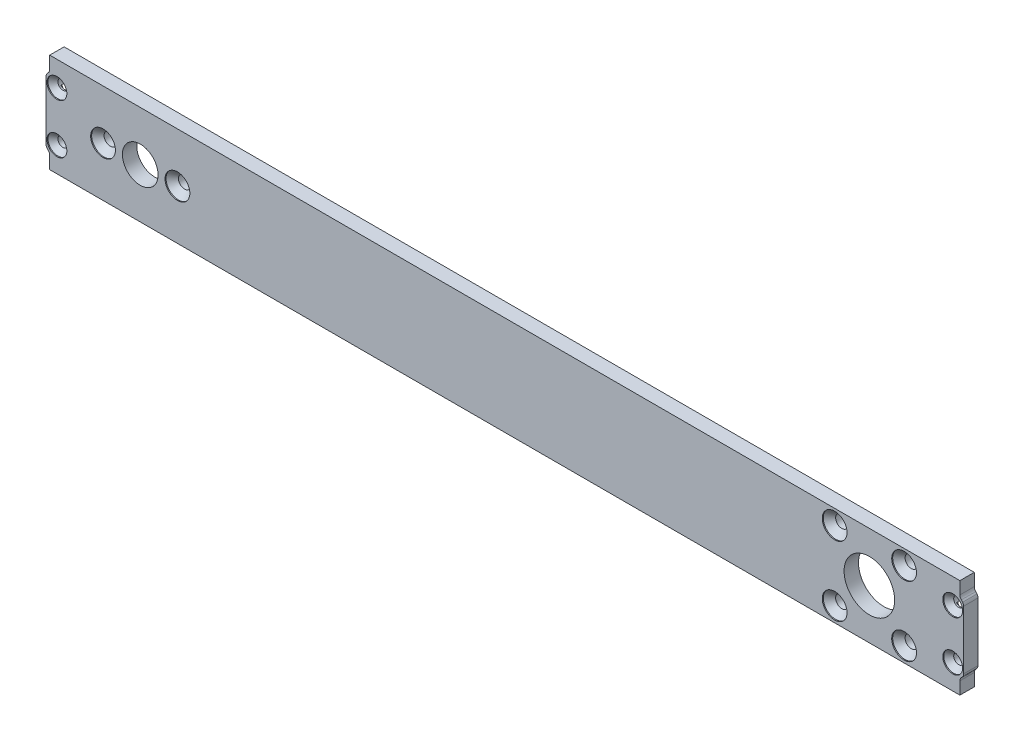
from build123d import *
from build123d.topology import SkipClean

# Parameters (mm, degrees)
SKETCH1_W                          = 185
SKETCH1_H                          = 20
BASE_SHAPE_DEPTH                   = 2.9
MOTOR_CUTOUTS_REACH                = 95.084
SKETCH2_R                          = 1.25
SKETCH2_R_2                        = 3.6
SKETCH2_R_3                        = 5.1
PCB_SLOT_DEPTH                     = 0.775
END_PLATE_HOLES_REACH              = 95.084
SKETCH6_R                          = 1
MOTOR_M2_5_COUNTERSUNKS_AT_2_COUNT = 2
MOTOR_M2_5_COUNTERSUNKS_AT_2_PITCH = 15
MOTOR_M2_5_COUNTERSUNKS_AT_3_COUNT = 2
MOTOR_M2_5_COUNTERSUNKS_AT_3_PITCH = 147.666008275
MOTOR_M2_5_COUNTERSUNKS_AT_4_COUNT = 2
MOTOR_M2_5_COUNTERSUNKS_AT_4_PITCH = 161.651631603
MOTOR_M2_5_COUNTERSUNKS_AT_5_COUNT = 2
MOTOR_M2_5_COUNTERSUNKS_AT_5_PITCH = 147.666008275
MOTOR_M2_5_COUNTERSUNKS_AT_6_COUNT = 2
MOTOR_M2_5_COUNTERSUNKS_AT_6_PITCH = 161.651631603
END_M2_COUNTERSUNKS_AT_2_COUNT     = 2
END_M2_COUNTERSUNKS_AT_2_PITCH     = 10
END_M2_COUNTERSUNKS_AT_3_COUNT     = 2
END_M2_COUNTERSUNKS_AT_3_PITCH     = 180.6
END_M2_COUNTERSUNKS_AT_4_COUNT     = 2
END_M2_COUNTERSUNKS_AT_4_PITCH     = 180.876643047
TAP_START                          = -1.4
TAP_SLOTS_DEPTH                    = 1.4
CUT_EXTRUDE3_REACH                 = 95.084
FILLET1_R                          = 1


with BuildPart() as part:
    # Sketch1 → Base shape (new body)
    with BuildSketch(Plane.XY):
        Rectangle(SKETCH1_W, SKETCH1_H)
    extrude(amount=-BASE_SHAPE_DEPTH)

    # Sketch2 → Motor cutouts (cut, up to next)
    with BuildSketch(Plane.XY, mode=Mode.PRIVATE) as motor_cutouts_sk1:
        with Locations((-81, 0)):
            Circle(SKETCH2_R)
    motor_cutouts_tool1 = extrude(motor_cutouts_sk1.sketch, amount=-MOTOR_CUTOUTS_REACH, mode=Mode.PRIVATE) & part.part
    # Sketch2 → Motor cutouts (cut, up to next)
    with BuildSketch(Plane.XY, mode=Mode.PRIVATE) as motor_cutouts_sk2:
        with Locations((-66, 0)):
            Circle(SKETCH2_R)
    motor_cutouts_tool2 = extrude(motor_cutouts_sk2.sketch, amount=-MOTOR_CUTOUTS_REACH, mode=Mode.PRIVATE) & part.part
    # Sketch2 → Motor cutouts (cut, up to next)
    with BuildSketch(Plane.XY, mode=Mode.PRIVATE) as motor_cutouts_sk3:
        with Locations((-73.5, 0)):
            Circle(SKETCH2_R_2)
    motor_cutouts_tool3 = extrude(motor_cutouts_sk3.sketch, amount=-MOTOR_CUTOUTS_REACH, mode=Mode.PRIVATE) & part.part
    # Sketch2 → Motor cutouts (cut, up to next)
    with BuildSketch(Plane.XY, mode=Mode.PRIVATE) as motor_cutouts_sk4:
        with Locations((73.5, 0)):
            Circle(SKETCH2_R_3)
    motor_cutouts_tool4 = extrude(motor_cutouts_sk4.sketch, amount=-MOTOR_CUTOUTS_REACH, mode=Mode.PRIVATE) & part.part
    # Sketch2 → Motor cutouts (cut, up to next)
    with BuildSketch(Plane.XY, mode=Mode.PRIVATE) as motor_cutouts_sk5:
        with Locations((66.5, 7)):
            Circle(SKETCH2_R)
    motor_cutouts_tool5 = extrude(motor_cutouts_sk5.sketch, amount=-MOTOR_CUTOUTS_REACH, mode=Mode.PRIVATE) & part.part
    # Sketch2 → Motor cutouts (cut, up to next)
    with BuildSketch(Plane.XY, mode=Mode.PRIVATE) as motor_cutouts_sk6:
        with Locations((80.5, 7)):
            Circle(SKETCH2_R)
    motor_cutouts_tool6 = extrude(motor_cutouts_sk6.sketch, amount=-MOTOR_CUTOUTS_REACH, mode=Mode.PRIVATE) & part.part
    # Sketch2 → Motor cutouts (cut, up to next)
    with BuildSketch(Plane.XY, mode=Mode.PRIVATE) as motor_cutouts_sk7:
        with Locations((80.5, -7)):
            Circle(SKETCH2_R)
    motor_cutouts_tool7 = extrude(motor_cutouts_sk7.sketch, amount=-MOTOR_CUTOUTS_REACH, mode=Mode.PRIVATE) & part.part
    # Sketch2 → Motor cutouts (cut, up to next)
    with BuildSketch(Plane.XY, mode=Mode.PRIVATE) as motor_cutouts_sk8:
        with Locations((66.5, -7)):
            Circle(SKETCH2_R)
    motor_cutouts_tool8 = extrude(motor_cutouts_sk8.sketch, amount=-MOTOR_CUTOUTS_REACH, mode=Mode.PRIVATE) & part.part
    add(motor_cutouts_tool1.solids().sort_by_distance((-81, 0, 0))[0], mode=Mode.SUBTRACT)
    add(motor_cutouts_tool2.solids().sort_by_distance((-66, 0, 0))[0], mode=Mode.SUBTRACT)
    add(motor_cutouts_tool3.solids().sort_by_distance((-73.5, 0, 0))[0], mode=Mode.SUBTRACT)
    add(motor_cutouts_tool4.solids().sort_by_distance((73.5, 0, 0))[0], mode=Mode.SUBTRACT)
    add(motor_cutouts_tool5.solids().sort_by_distance((66.5, 7, 0))[0], mode=Mode.SUBTRACT)
    add(motor_cutouts_tool6.solids().sort_by_distance((80.5, 7, 0))[0], mode=Mode.SUBTRACT)
    add(motor_cutouts_tool7.solids().sort_by_distance((80.5, -7, 0))[0], mode=Mode.SUBTRACT)
    add(motor_cutouts_tool8.solids().sort_by_distance((66.5, -7, 0))[0], mode=Mode.SUBTRACT)

    # Sketch5 → PCB slot (cut)
    with BuildSketch(Plane(origin=(0, 0, -2.9), x_dir=(-1, 0, 0), z_dir=(0, 0, -1))):
        with BuildLine():
            Line((-60, -6), (60, -6))
            ThreePointArc((60, -6), (61, -7), (60, -8))
            Line((60, -8), (-60, -8))
            ThreePointArc((-60, -8), (-61, -7), (-60, -6))
        make_face()
    extrude(amount=-PCB_SLOT_DEPTH, mode=Mode.SUBTRACT)

    # Sketch6 → End plate holes (cut, up to next)
    with BuildSketch(Plane.XY, mode=Mode.PRIVATE) as end_plate_holes_sk1:
        with Locations((90.3, 5)):
            Circle(SKETCH6_R)
    end_plate_holes_tool1 = extrude(end_plate_holes_sk1.sketch, amount=-END_PLATE_HOLES_REACH, mode=Mode.PRIVATE) & part.part
    # Sketch6 → End plate holes (cut, up to next)
    with BuildSketch(Plane.XY, mode=Mode.PRIVATE) as end_plate_holes_sk2:
        with Locations((90.3, -5)):
            Circle(SKETCH6_R)
    end_plate_holes_tool2 = extrude(end_plate_holes_sk2.sketch, amount=-END_PLATE_HOLES_REACH, mode=Mode.PRIVATE) & part.part
    # Sketch6 → End plate holes (cut, up to next)
    with BuildSketch(Plane.XY, mode=Mode.PRIVATE) as end_plate_holes_sk3:
        with Locations((-90.3, -5)):
            Circle(SKETCH6_R)
    end_plate_holes_tool3 = extrude(end_plate_holes_sk3.sketch, amount=-END_PLATE_HOLES_REACH, mode=Mode.PRIVATE) & part.part
    # Sketch6 → End plate holes (cut, up to next)
    with BuildSketch(Plane.XY, mode=Mode.PRIVATE) as end_plate_holes_sk4:
        with Locations((-90.3, 5)):
            Circle(SKETCH6_R)
    end_plate_holes_tool4 = extrude(end_plate_holes_sk4.sketch, amount=-END_PLATE_HOLES_REACH, mode=Mode.PRIVATE) & part.part
    add(end_plate_holes_tool1.solids().sort_by_distance((90.3, 5, 0))[0], mode=Mode.SUBTRACT)
    add(end_plate_holes_tool2.solids().sort_by_distance((90.3, -5, 0))[0], mode=Mode.SUBTRACT)
    add(end_plate_holes_tool3.solids().sort_by_distance((-90.3, -5, 0))[0], mode=Mode.SUBTRACT)
    add(end_plate_holes_tool4.solids().sort_by_distance((-90.3, 5, 0))[0], mode=Mode.SUBTRACT)

    # Sketch4 → Motor M2.5 countersunks (revolve, cut)
    with BuildSketch(Plane(origin=(-81, 0, 0), x_dir=(0, -1, 0), z_dir=(1, 0, 0))):
        Polygon((0, 0), (0, 2.9), (1.25, 2.9), (1.25, 1.45), (2.5, 0.2), (2.5, 0), align=None)
    motor_m2_5_countersunks = revolve(axis=Axis((-81, 0, 6.35), (0, 0, -1)), mode=Mode.SUBTRACT)

    # Motor M2.5 countersunks at 2: Motor M2.5 countersunks ×2
    with Locations(*[(i * MOTOR_M2_5_COUNTERSUNKS_AT_2_PITCH, 0, 0) for i in range(1, MOTOR_M2_5_COUNTERSUNKS_AT_2_COUNT)]):
        add(motor_m2_5_countersunks, mode=Mode.SUBTRACT)

    # Motor M2.5 countersunks at 3: Motor M2.5 countersunks ×2
    with Locations(*[Vector(0.9988757854473691, 0.047404274563603965, 0) * (i * MOTOR_M2_5_COUNTERSUNKS_AT_3_PITCH) for i in range(1, MOTOR_M2_5_COUNTERSUNKS_AT_3_COUNT)]):
        add(motor_m2_5_countersunks, mode=Mode.SUBTRACT)

    # Motor M2.5 countersunks at 4: Motor M2.5 countersunks ×2
    with Locations(*[Vector(0.9990619853213468, 0.043302996267798335, 0) * (i * MOTOR_M2_5_COUNTERSUNKS_AT_4_PITCH) for i in range(1, MOTOR_M2_5_COUNTERSUNKS_AT_4_COUNT)]):
        add(motor_m2_5_countersunks, mode=Mode.SUBTRACT)

    # Motor M2.5 countersunks at 5: Motor M2.5 countersunks ×2
    with Locations(*[Vector(0.9988757854473691, -0.04740427456360395, 0) * (i * MOTOR_M2_5_COUNTERSUNKS_AT_5_PITCH) for i in range(1, MOTOR_M2_5_COUNTERSUNKS_AT_5_COUNT)]):
        add(motor_m2_5_countersunks, mode=Mode.SUBTRACT)

    # Motor M2.5 countersunks at 6: Motor M2.5 countersunks ×2
    with Locations(*[Vector(0.9990619853213468, -0.0433029962677983, 0) * (i * MOTOR_M2_5_COUNTERSUNKS_AT_6_PITCH) for i in range(1, MOTOR_M2_5_COUNTERSUNKS_AT_6_COUNT)]):
        add(motor_m2_5_countersunks, mode=Mode.SUBTRACT)

    # Sketch9 → End M2 countersunks (revolve, cut)
    with BuildSketch(Plane(origin=(90.3, 5, 0), x_dir=(0, -1, 0), z_dir=(1, 0, 0))):
        Polygon((0, 0), (0, 2.9), (1, 2.9), (1, 1.2), (2, 0.2), (2, 0), align=None)
    end_m2_countersunks = revolve(axis=Axis((90.3, 5, 6.35), (0, 0, -1)), mode=Mode.SUBTRACT)

    # End M2 countersunks at 2: End M2 countersunks ×2
    with Locations(*[(0, -i * END_M2_COUNTERSUNKS_AT_2_PITCH, 0) for i in range(1, END_M2_COUNTERSUNKS_AT_2_COUNT)]):
        add(end_m2_countersunks, mode=Mode.SUBTRACT)

    # End M2 countersunks at 3: End M2 countersunks ×2
    with Locations(*[(-i * END_M2_COUNTERSUNKS_AT_3_PITCH, 0, 0) for i in range(1, END_M2_COUNTERSUNKS_AT_3_COUNT)]):
        add(end_m2_countersunks, mode=Mode.SUBTRACT)

    # End M2 countersunks at 4: End M2 countersunks ×2
    with Locations(*[Vector(-0.9984705430039356, -0.055286298062233535, 0) * (i * END_M2_COUNTERSUNKS_AT_4_PITCH) for i in range(1, END_M2_COUNTERSUNKS_AT_4_COUNT)]):
        add(end_m2_countersunks, mode=Mode.SUBTRACT)

    # Sketch12 → Tap slots (cut)
    with SkipClean():  # the faces are left unmerged after this step: merging them gives an invalid solid
        with BuildSketch(Plane(origin=(0, 0, -2.9), x_dir=(-1, 0, 0), z_dir=(0, 0, -1)).offset(TAP_START)):
            with BuildLine():
                Line((-91.9, 2.635786438), (-91.9, -2.635786438))
                ThreePointArc((-91.9, -2.635786438), (-92.085607903, -3.793515558), (-91.043923255, -4.33173494))
                ThreePointArc((-91.043923255, -4.33173494), (-91.048881163, -4.337295689), (-91.053797505, -4.342893219))
                Line((-91.053797505, -4.342893219), (-89.546202495, -4.342893219))
                ThreePointArc((-89.546202495, -4.342893219), (-89.551118837, -4.337295689), (-89.556076745, -4.33173494))
                ThreePointArc((-89.556076745, -4.33173494), (-88.514392097, -3.793515558), (-88.7, -2.635786438))
                Line((-88.7, -2.635786438), (-88.7, 2.635786438))
                ThreePointArc((-88.7, 2.635786438), (-88.514392097, 3.793515558), (-89.556076745, 4.33173494))
                ThreePointArc((-89.556076745, 4.33173494), (-89.551118837, 4.337295689), (-89.546202495, 4.342893219))
                Line((-89.546202495, 4.342893219), (-91.053797505, 4.342893219))
                ThreePointArc((-91.053797505, 4.342893219), (-91.048881163, 4.337295689), (-91.043923255, 4.33173494))
                ThreePointArc((-91.043923255, 4.33173494), (-92.085607903, 3.793515558), (-91.9, 2.635786438))
            make_face()
            with BuildLine():
                Line((91.9, -2.635786438), (91.9, 2.635786438))
                ThreePointArc((91.9, 2.635786438), (92.085607903, 3.793515558), (91.043923255, 4.33173494))
                ThreePointArc((91.043923255, 4.33173494), (91.048881163, 4.337295689), (91.053797505, 4.342893219))
                Line((91.053797505, 4.342893219), (89.546202495, 4.342893219))
                ThreePointArc((89.546202495, 4.342893219), (89.551118837, 4.337295689), (89.556076745, 4.33173494))
                ThreePointArc((89.556076745, 4.33173494), (88.514392097, 3.793515558), (88.7, 2.635786438))
                Line((88.7, 2.635786438), (88.7, -2.635786438))
                ThreePointArc((88.7, -2.635786438), (88.514392097, -3.793515558), (89.556076745, -4.33173494))
                ThreePointArc((89.556076745, -4.33173494), (89.551118837, -4.337295689), (89.546202495, -4.342893219))
                Line((89.546202495, -4.342893219), (91.053797505, -4.342893219))
                ThreePointArc((91.053797505, -4.342893219), (91.048881163, -4.337295689), (91.043923255, -4.33173494))
                ThreePointArc((91.043923255, -4.33173494), (92.085607903, -3.793515558), (91.9, -2.635786438))
            make_face()
        extrude(amount=TAP_SLOTS_DEPTH, mode=Mode.SUBTRACT)

    # Sketch13 → Cut-Extrude3 (cut, up to next)
    with BuildSketch(Plane.XY, mode=Mode.PRIVATE) as cut_extrude3_sk1:
        with BuildLine():
            Line((-91.75, 10), (-92.5, 10))
            Line((-92.5, 10), (-92.5, 6.187434209))
            ThreePointArc((-92.5, 6.187434209), (-92.173731748, 6.655031521), (-91.75, 7.036541185))
            Line((-91.75, 7.036541185), (-91.75, 10))
        make_face()
    cut_extrude3_tool1 = extrude(cut_extrude3_sk1.sketch, amount=-CUT_EXTRUDE3_REACH, mode=Mode.PRIVATE) & part.part
    # Sketch13 → Cut-Extrude3 (cut, up to next)
    with BuildSketch(Plane.XY, mode=Mode.PRIVATE) as cut_extrude3_sk2:
        with BuildLine():
            Line((92.5, 10), (91.75, 10))
            Line((91.75, 10), (91.75, 7.036541185))
            ThreePointArc((91.75, 7.036541185), (92.173731748, 6.655031521), (92.5, 6.187434209))
            Line((92.5, 6.187434209), (92.5, 10))
        make_face()
    cut_extrude3_tool2 = extrude(cut_extrude3_sk2.sketch, amount=-CUT_EXTRUDE3_REACH, mode=Mode.PRIVATE) & part.part
    # Sketch13 → Cut-Extrude3 (cut, up to next)
    with BuildSketch(Plane.XY, mode=Mode.PRIVATE) as cut_extrude3_sk3:
        with BuildLine():
            ThreePointArc((-91.75, -7.036541185), (-92.173731748, -6.655031521), (-92.5, -6.187434209))
            Line((-92.5, -6.187434209), (-92.5, -10))
            Line((-92.5, -10), (-91.75, -10))
            Line((-91.75, -10), (-91.75, -7.036541185))
        make_face()
    cut_extrude3_tool3 = extrude(cut_extrude3_sk3.sketch, amount=-CUT_EXTRUDE3_REACH, mode=Mode.PRIVATE) & part.part
    # Sketch13 → Cut-Extrude3 (cut, up to next)
    with BuildSketch(Plane.XY, mode=Mode.PRIVATE) as cut_extrude3_sk4:
        with BuildLine():
            ThreePointArc((92.5, -6.187434209), (92.173731748, -6.655031521), (91.75, -7.036541185))
            Line((91.75, -7.036541185), (91.75, -10))
            Line((91.75, -10), (92.5, -10))
            Line((92.5, -10), (92.5, -6.187434209))
        make_face()
    cut_extrude3_tool4 = extrude(cut_extrude3_sk4.sketch, amount=-CUT_EXTRUDE3_REACH, mode=Mode.PRIVATE) & part.part
    add(cut_extrude3_tool1.solids().sort_by_distance((-92.140588, 8.330084, 0))[0], mode=Mode.SUBTRACT)
    add(cut_extrude3_tool2.solids().sort_by_distance((92.140588, 8.330084, 0))[0], mode=Mode.SUBTRACT)
    add(cut_extrude3_tool3.solids().sort_by_distance((-92.140588, -8.330084, 0))[0], mode=Mode.SUBTRACT)
    add(cut_extrude3_tool4.solids().sort_by_distance((92.140588, -8.330084, 0))[0], mode=Mode.SUBTRACT)

    # Fillet1
    fillet1_edges = [part.edges().sort_by_distance(p)[0] for p in [
        (-91.75, -7.036541185, -1.45),
        (-92.5, -6.187434209, -1.45),
        (-92.5, 6.187434209, -1.45),
        (-91.75, 7.036541185, -1.45),
        (92.5, 6.187434209, -1.45),
        (91.75, 7.036541185, -1.45),
        (92.5, -6.187434209, -1.45),
        (91.75, -7.036541185, -1.45),
    ]]
    fillet(fillet1_edges, radius=FILLET1_R)


solid = part.part
